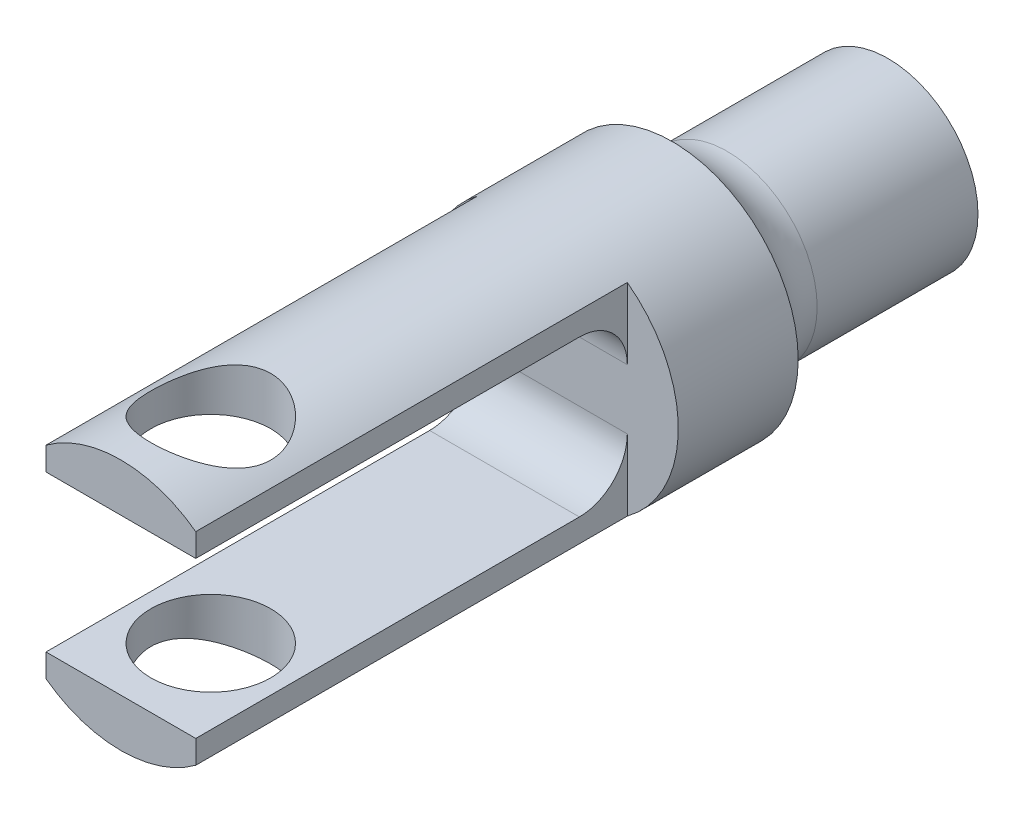
from build123d import *

# Parameters (mm, degrees)
SZKIC1_R                               = 15
DODANIE_WYCI_GNI_CIE1_DEPTH            = 36
SZKIC3_R                               = 21
SZKIC3_R_2                             = 11.115
DODANIE_WYCI_GNI_CIE2_DEPTH            = 20
DODANIE_WYCI_GNI_CIE4_START            = -17
SZKIC5_R                               = 11.115
DODANIE_WYCI_GNI_CIE4_DEPTH            = 17
ZAOKR_GLENIE1_R                        = 10
DODANIE_WYCI_GNI_CIE3_DEPTH            = 72
ZAOKR_GLENIE2_R                        = 8
WYTNIJ_WYCI_GNI_CIE1_REACH             = 136.093
SZKIC6_R                               = 10
WYTNIJ_WYCI_GNI_CIE1_DIRECTION_2_DEPTH = 135.093251135


with BuildPart() as part:
    # Szkic1 → Dodanie-wyciągnięcie1 (new body)
    with BuildSketch(Plane.XY):
        Circle(SZKIC1_R)
        with BuildLine():
            Line((-2.39, 10.855004606), (-2.39, 12.465))
            Line((-2.39, 12.465), (2.39, 12.465))
            Line((2.39, 12.465), (2.39, 10.855004606))
            ThreePointArc((2.39, 10.855004606), (8.663373333, 6.963417803), (11.115, 0))
            ThreePointArc((11.115, 0), (-6.963417803, -8.663373333), (-2.39, 10.855004606))
        make_face(mode=Mode.SUBTRACT)
    extrude(amount=DODANIE_WYCI_GNI_CIE1_DEPTH)

    # Szkic3 → Dodanie-wyciągnięcie2 (add)
    with BuildSketch(Plane.XY.offset(36)):
        Circle(SZKIC3_R)
        with Locations(Location((0, 0, 0), (0, 0, 102.416978829))):
            Circle(SZKIC3_R_2, mode=Mode.SUBTRACT)
    extrude(amount=DODANIE_WYCI_GNI_CIE2_DEPTH)

    # Szkic5 → Dodanie-wyciągnięcie4 (add)
    with BuildSketch(Plane.XY.offset(56).offset(DODANIE_WYCI_GNI_CIE4_START)):
        with Locations(Location((0, 0, 0), (0, 0, 102.416978829))):
            Circle(SZKIC5_R)
    extrude(amount=DODANIE_WYCI_GNI_CIE4_DEPTH)

    # Zaokrąglenie1
    # the kernel refuses this fillet: 10 mm, written as the material it adds along each edge
    with BuildSketch(Plane(origin=(0, 0, 36), x_dir=(1, 0, 0), z_dir=(0, -1, 0))) as zaokr_glenie1_piece_1:
        with BuildLine():
            CenterArc((25, -9.16515139), ZAOKR_GLENIE1_R, 113.578178478, 66.421821522)
            Line((21, 0), (20.92, 0.183303028))
            ThreePointArc((20.92, 0.183303028), (18, 0.2), (15, 0.2))
            Line((15, 0.2), (14.8, 0))
            Line((14.8, 0), (14.8, -9.16515139))
            Line((14.8, -9.16515139), (15, -9.16515139))
        make_face()
    revolve(axis=Axis((0, 0, 36), (0, 0, 1)))

    # Szkic4 → Dodanie-wyciągnięcie3 (add)
    with BuildSketch(Plane.XY.offset(56)):
        with BuildLine():
            Line((-12.492422502, 16.880147512), (-12.492422502, 13))
            Line((-12.492422502, 13), (12.492422502, 13))
            Line((12.492422502, 13), (12.492422502, 16.880147512))
            ThreePointArc((12.492422502, 16.880147512), (0, 21), (-12.492422502, 16.880147512))
        make_face()
        with BuildLine():
            Line((12.492422502, -13), (-12.492422502, -13))
            Line((-12.492422502, -13), (-12.492422502, -16.880147512))
            ThreePointArc((-12.492422502, -16.880147512), (0, -21), (12.492422502, -16.880147512))
            Line((12.492422502, -16.880147512), (12.492422502, -13))
        make_face()
    extrude(amount=DODANIE_WYCI_GNI_CIE3_DEPTH)

    # Zaokrąglenie2
    zaokr_glenie2_edges = [part.edges().sort_by_distance(p)[0] for p in [
        (0, 13, 56),
        (0, -13, 56),
    ]]
    fillet(zaokr_glenie2_edges, radius=ZAOKR_GLENIE2_R)

    # Szkic6 → Wytnij-wyciągnięcie1 (cut, up to next)
    with BuildSketch(Plane(origin=(0, -13, 0), x_dir=(1, 0, 0), z_dir=(0, 1, 0)), mode=Mode.PRIVATE) as wytnij_wyci_gni_cie1_sk1:
        with Locations(Location((0, -113, 0), (0, 0, 270))):
            Circle(SZKIC6_R)
    wytnij_wyci_gni_cie1_tool1 = extrude(wytnij_wyci_gni_cie1_sk1.sketch, amount=-WYTNIJ_WYCI_GNI_CIE1_REACH, mode=Mode.PRIVATE) & part.part
    add(wytnij_wyci_gni_cie1_tool1.solids().sort_by_distance((0, -13, 113))[0], mode=Mode.SUBTRACT)

    # Szkic6 → Wytnij-wyciągnięcie1 direction 2 (cut)
    with BuildSketch(Plane(origin=(0, -13, 0), x_dir=(1, 0, 0), z_dir=(0, 1, 0))):
        with Locations(Location((0, -113, 0), (0, 0, 270))):
            Circle(SZKIC6_R)
    extrude(amount=WYTNIJ_WYCI_GNI_CIE1_DIRECTION_2_DEPTH, mode=Mode.SUBTRACT)


solid = part.part
